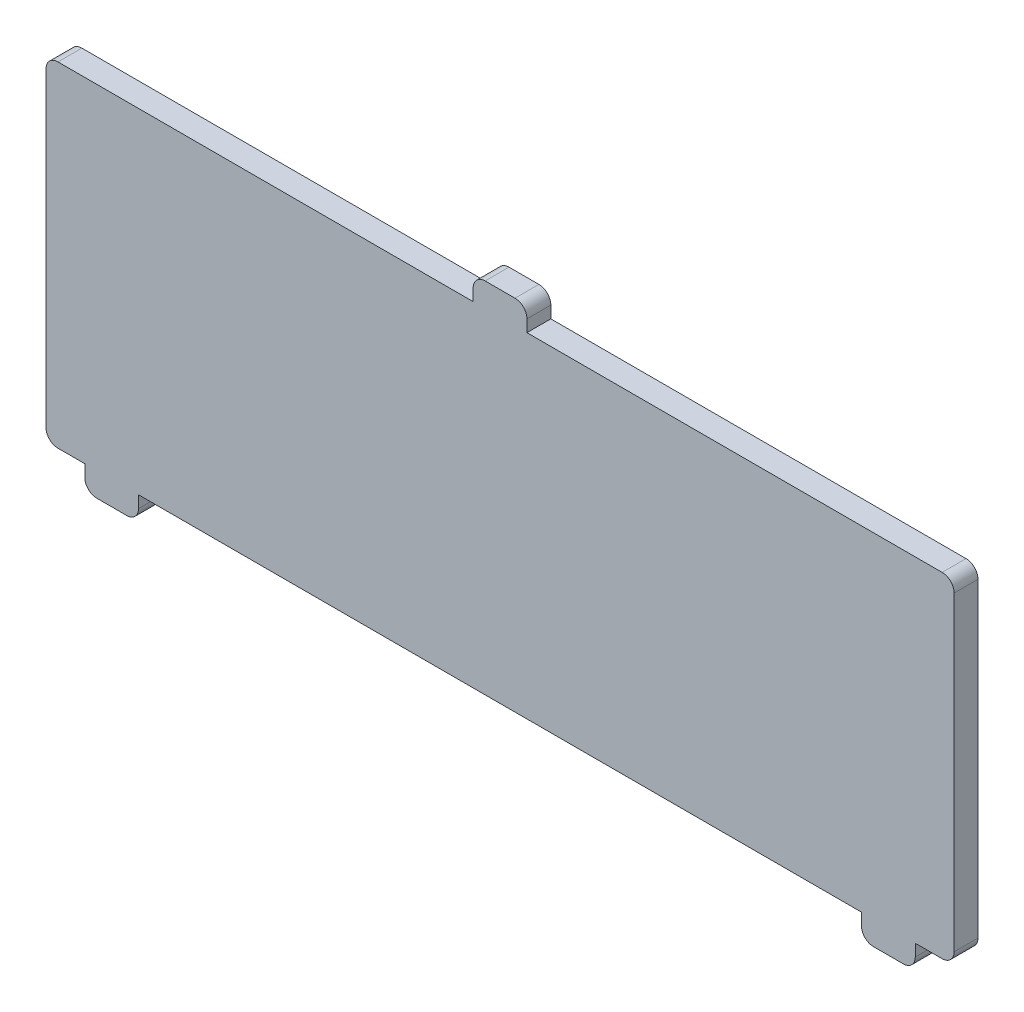
from build123d import *

# Parameters (mm, degrees)
BOSS_EXTRUDE1_DEPTH = 1
FILLET1_R           = 1


with BuildPart() as part:
    # Sketch1 → Boss-Extrude1 (new, symmetric)
    with BuildSketch(Plane.XY):
        Polygon((-2.25, 14), (-38, 14), (-38, -14), (-34.75, -14), (-34.75, -16), (-30.25, -16), (-30.25, -14), (30.25, -14), (30.25, -16), (34.75, -16), (34.75, -14), (38, -14), (38, 14), (2.25, 14), (2.25, 16), (-2.25, 16), align=None)
    extrude(amount=BOSS_EXTRUDE1_DEPTH, both=True)

    # Fillet1
    fillet1_edges = [part.edges().sort_by_distance(p)[0] for p in [
        (-38, 14, 0),
        (-30.25, -16, 0),
        (-34.75, -16, 0),
        (-38, -14, 0),
        (30.25, -16, 0),
        (34.75, -16, 0),
        (38, -14, 0),
        (38, 14, 0),
        (2.25, 16, 0),
        (-2.25, 16, 0),
    ]]
    fillet(fillet1_edges, radius=FILLET1_R)


solid = part.part
